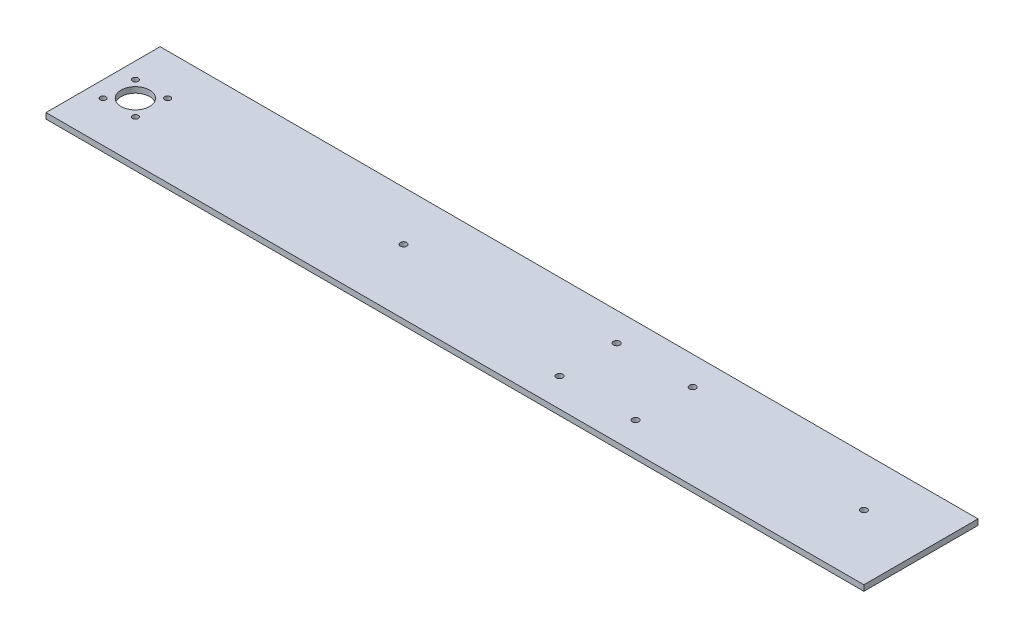
from build123d import *

# Parameters (mm, degrees)
SKETCH1_W                 = 430
SKETCH1_H                 = 60
BOSS_EXTRUDE1_DEPTH       = 3
OTW_R_POD_RUB_M31_D       = 3.4
SKETCH4_R                 = 7.5
CUT_EXTRUDE1_DEPTH        = 5
F_3_0MM_DOWEL_HOLE1_D     = 3
F_3_0MM_DOWEL_HOLE1_DEPTH = 6
F_3_0MM_DOWEL_HOLE1_TIP   = 0.901290929


with BuildPart() as part:
    # Sketch1 → Boss-Extrude1 (new body)
    with BuildSketch(Plane(origin=(0, 0, 0), x_dir=(1, 0, 0), z_dir=(0, 1, 0))):
        with Locations((85, 30)):
            Rectangle(SKETCH1_W, SKETCH1_H)
    extrude(amount=BOSS_EXTRUDE1_DEPTH)

    # Otwór pod śrubę M31 (through all)
    with Locations(Plane(origin=(0, 3, 0), x_dir=(1, 0, 0), z_dir=(0, 1, 0))):
        with Locations((266, 34), (24, 34), (125, 15), (165, 15), (165, 45), (125, 45)):
            Hole(OTW_R_POD_RUB_M31_D / 2)

    # Sketch4 → Cut-Extrude1 (cut)
    with BuildSketch(Plane(origin=(0, 3, 0), x_dir=(1, 0, 0), z_dir=(0, 1, 0))):
        with Locations((-113, 30)):
            Circle(SKETCH4_R)
    extrude(amount=-CUT_EXTRUDE1_DEPTH, mode=Mode.SUBTRACT)

    # Ø3.0mm Dowel Hole1
    with Locations(Plane(origin=(0, 3, 0), x_dir=(1, 0, 0), z_dir=(0, 1, 0))):
        with Locations((-104.514718626, 21.514718626), (-104.514718626, 38.485281374), (-121.485281374, 21.514718626), (-121.485281374, 38.485281374)):
            Hole(F_3_0MM_DOWEL_HOLE1_D / 2, depth=F_3_0MM_DOWEL_HOLE1_DEPTH)
            with Locations((0, 0, -(F_3_0MM_DOWEL_HOLE1_DEPTH + F_3_0MM_DOWEL_HOLE1_TIP / 2))):  # 118° drill point
                Cone(0, F_3_0MM_DOWEL_HOLE1_D / 2, F_3_0MM_DOWEL_HOLE1_TIP, mode=Mode.SUBTRACT)


solid = part.part
